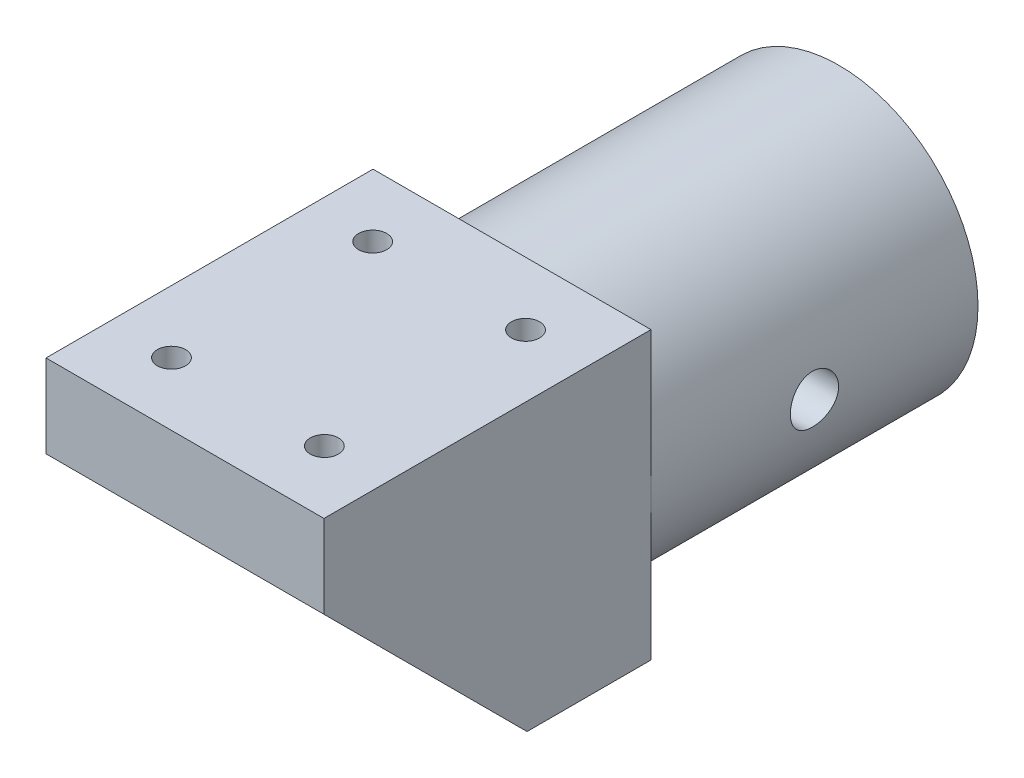
from build123d import *

# Parameters (mm, degrees)
SKETCH1_R                = 17.272
SKETCH1_R_2              = 9.652
BOSS_EXTRUDE1_DEPTH      = 40.64
BOSS_EXTRUDE2_DEPTH      = 17.78
BOSS_EXTRUDE2_DEPTH_BACK = 17.78
SKETCH3_W                = 34.544
SKETCH3_H                = 40.64
CHAMFER1_SIZE            = 25.24
SKETCH5_R                = 1.75
CUT_EXTRUDE2_DEPTH       = 40.64
SKETCH7_R                = 6.35
CUT_EXTRUDE6_DEPTH       = 30.48
CUT_EXTRUDE7_DEPTH       = 30.48
CUT_EXTRUDE7_DEPTH_BACK  = 30.48
SKETCH8_R                = 3


with BuildPart() as part:
    # Sketch1 → Boss-Extrude1 (new body)
    with BuildSketch(Plane.XY):
        Circle(SKETCH1_R)
        Circle(SKETCH1_R_2, mode=Mode.SUBTRACT)
    extrude(amount=BOSS_EXTRUDE1_DEPTH)

    # Sketch3 → Boss-Extrude2 (add, two sides: drawn at the far end of the back side and taken through both)
    with BuildSketch(Plane(origin=(0, 0, 0), x_dir=(1, 0, 0), z_dir=(0, 1, 0)).offset(-BOSS_EXTRUDE2_DEPTH_BACK)):
        with Locations((0, -60.96)):
            Rectangle(SKETCH3_W, SKETCH3_H)
    extrude(amount=BOSS_EXTRUDE2_DEPTH + BOSS_EXTRUDE2_DEPTH_BACK)

    # Chamfer1
    chamfer1_edges = [part.edges().sort_by_distance(p)[0] for p in [
        (0, -17.78, 81.28),
    ]]
    chamfer(chamfer1_edges, length=CHAMFER1_SIZE)

    # Sketch5 → Cut-Extrude2 (cut)
    with BuildSketch(Plane(origin=(0, 17.78, 0), x_dir=(1, 0, 0), z_dir=(0, 1, 0))):
        with Locations((-9.5, -48.46)):
            Circle(SKETCH5_R)
        with Locations((9.5, -48.46)):
            Circle(SKETCH5_R)
        with Locations((9.5, -73.46)):
            Circle(SKETCH5_R)
        with Locations((-9.5, -73.46)):
            Circle(SKETCH5_R)
    extrude(amount=-CUT_EXTRUDE2_DEPTH, mode=Mode.SUBTRACT)

    # Sketch7 → Cut-Extrude6 (cut)
    with BuildSketch(Plane.XZ.offset(17.78)):
        with Locations((-9.5, 73.46)):
            Circle(SKETCH7_R)
        with Locations((9.5, 73.46)):
            Circle(SKETCH7_R)
        with Locations((-9.5, 48.46)):
            Circle(SKETCH7_R)
        with Locations((9.5, 48.46)):
            Circle(SKETCH7_R)
    extrude(amount=-CUT_EXTRUDE6_DEPTH, mode=Mode.SUBTRACT)

    # Sketch8 → Cut-Extrude7 (cut, two sides: drawn at the far end of the back side and taken through both)
    with BuildSketch(Plane(origin=(0, 0, 0), x_dir=(0, 0, -1), z_dir=(1, 0, 0)).offset(-CUT_EXTRUDE7_DEPTH_BACK)):
        with Locations((-20.32, 0)):
            Circle(SKETCH8_R)
    extrude(amount=CUT_EXTRUDE7_DEPTH + CUT_EXTRUDE7_DEPTH_BACK, mode=Mode.SUBTRACT)


solid = part.part
